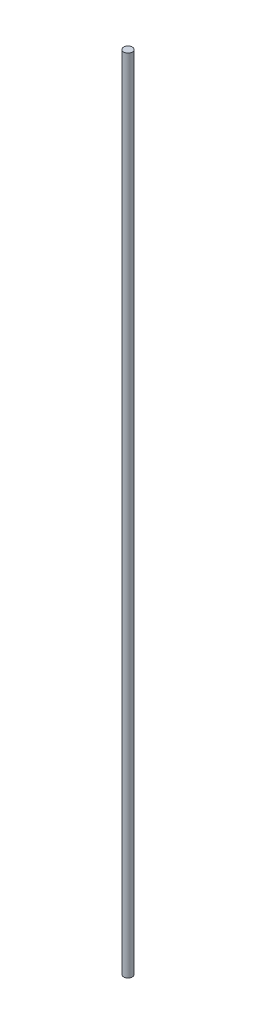
from build123d import *

# Parameters (mm, degrees)
SKETCH1_R           = 5.08
BOSS_EXTRUDE1_DEPTH = 932.688


with BuildPart() as part:
    # Sketch1 → Boss-Extrude1 (new body)
    with BuildSketch(Plane(origin=(0, 0, 0), x_dir=(1, 0, 0), z_dir=(0, 1, 0))):
        Circle(SKETCH1_R)
    extrude(amount=BOSS_EXTRUDE1_DEPTH)


solid = part.part
